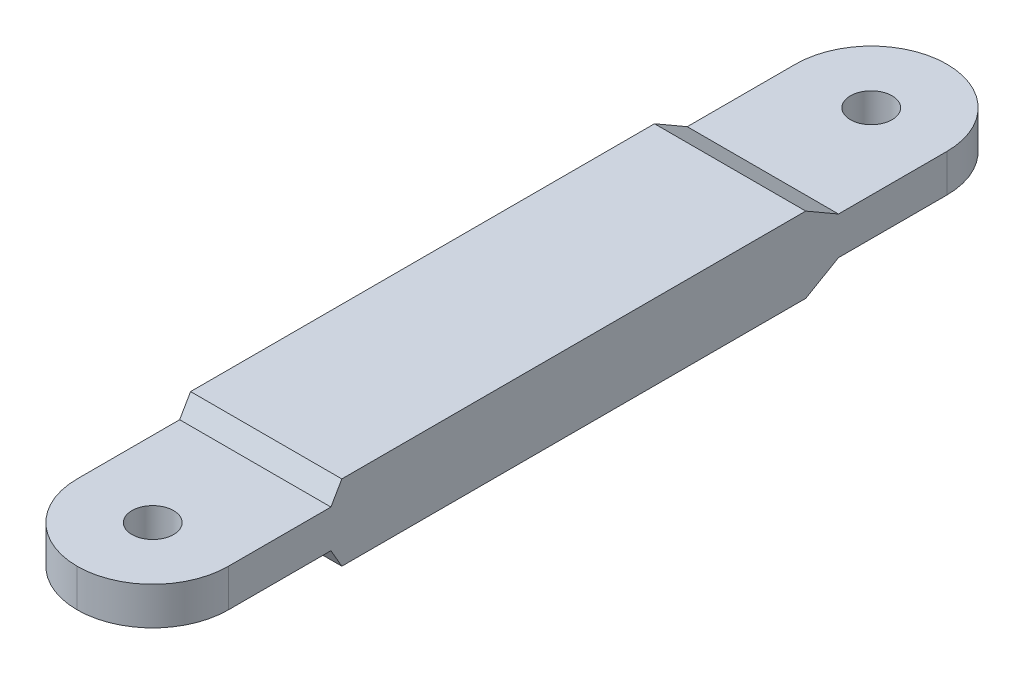
from build123d import *

# Parameters (mm, degrees)
BOSS_EXTRUDE1_DEPTH      = 37.5
BOSS_EXTRUDE1_DEPTH_BACK = 37.5
SKETCH1_W                = 20
SKETCH1_H                = 10
SKETCH3_W                = 20
SKETCH3_H                = 5
BOSS_EXTRUDE2_DEPTH      = 20
FILLET1_R                = 10
SKETCH4_R                = 2.75
CUT_EXTRUDE1_DEPTH       = 59.84301148
FILLET1_OF_MIRROR3_R     = 10
CHAMFER1_SIZE            = 8.660254038
CHAMFER1_SIZE_2          = 5


# Some blends are built 0.0001 mm under size
with BuildPart() as part:
    # Sketch1 → Boss-Extrude1 (new, two sides: drawn at the far end of the back side and taken through both)
    with BuildSketch(Plane.XY.offset(-BOSS_EXTRUDE1_DEPTH_BACK)):
        Rectangle(SKETCH1_W, SKETCH1_H)
    extrude(amount=BOSS_EXTRUDE1_DEPTH + BOSS_EXTRUDE1_DEPTH_BACK)

    # Sketch3 → Boss-Extrude2 (add)
    with BuildSketch(Plane(origin=(0, 0, -37.5), x_dir=(-1, 0, 0), z_dir=(0, 0, -1))):
        Rectangle(SKETCH3_W, SKETCH3_H)
    boss_extrude2 = extrude(amount=BOSS_EXTRUDE2_DEPTH)

    # Fillet1
    fillet1_edges = [part.edges().sort_by_distance(p)[0] for p in [
        (-10, 0, -57.5),
        (10, 0, -57.5),
    ]]
    fillet(fillet1_edges, radius=FILLET1_R - 0.0001)  # a hair under: the kernel refuses the full size

    # Sketch4 → Cut-Extrude1 (cut, through all)
    with BuildSketch(Plane(origin=(0, 2.5, 0), x_dir=(1, 0, 0), z_dir=(0, 1, 0))):
        with Locations(Location((0, 47.5, 0), (0, 0, 270))):
            Circle(SKETCH4_R)
    cut_extrude1 = extrude(amount=-CUT_EXTRUDE1_DEPTH, mode=Mode.SUBTRACT)

    # Mirror3: Boss-Extrude2, Cut-Extrude1 across plane
    add(boss_extrude2.mirror(Plane.XY))
    add(cut_extrude1.mirror(Plane.XY), mode=Mode.SUBTRACT)

    # Fillet1 of Mirror3
    fillet1_of_mirror3_edges = [part.edges().sort_by_distance(p)[0] for p in [
        (-10, 0, 57.5),
        (10, 0, 57.5),
    ]]
    fillet(fillet1_of_mirror3_edges, radius=FILLET1_OF_MIRROR3_R - 0.0001)  # a hair under: the kernel refuses the full size

    # Chamfer1
    # the kernel refuses this chamfer: 8.660254038, 5 mm, written as the material it takes off along each edge
    with BuildSketch(Plane(origin=(32.404819853, 5, -37.5), x_dir=(0, 0.019326765612700598, 0.9998132206222078), z_dir=(-1, 0, 0))) as chamfer1_piece_1_section:
        Polygon((CHAMFER1_SIZE * 0.999813220604, -CHAMFER1_SIZE * 0.0193267656124), (-CHAMFER1_SIZE_2 * 0.0193267656127, -CHAMFER1_SIZE_2 * 0.999813220622), (0, 0), align=None)
    chamfer1_piece_1 = extrude(amount=64.809639706, mode=Mode.PRIVATE)
    chamfer1_piece_1 = split(chamfer1_piece_1, bisect_by=Plane(origin=(0, 2.5, -34.039331058), z_dir=(0, 1, 0)), keep=Keep.TOP, mode=Mode.PRIVATE)
    add(chamfer1_piece_1, mode=Mode.SUBTRACT)
    with BuildSketch(Plane(origin=(-32.404819853, -5, -37.5), x_dir=(0, -0.019326765612700598, 0.9998132206222078), z_dir=(1, 0, 0))) as chamfer1_piece_2_section:
        Polygon((CHAMFER1_SIZE * 0.999813220604, -CHAMFER1_SIZE * 0.0193267656124), (-CHAMFER1_SIZE_2 * 0.0193267656127, -CHAMFER1_SIZE_2 * 0.999813220622), (0, 0), align=None)
    chamfer1_piece_2 = extrude(amount=64.809639706, mode=Mode.PRIVATE)
    chamfer1_piece_2 = split(chamfer1_piece_2, bisect_by=Plane(origin=(0, -2.5, -34.039331058), z_dir=(0, -1, 0)), keep=Keep.TOP, mode=Mode.PRIVATE)
    add(chamfer1_piece_2, mode=Mode.SUBTRACT)
    with BuildSketch(Plane(origin=(-32.404819853, -5, 37.5), x_dir=(0, 0.999813220622208, 0.019326765612700494), z_dir=(1, 0, 0))) as chamfer1_piece_3_section:
        Polygon((CHAMFER1_SIZE * 0.999813220604, -CHAMFER1_SIZE * 0.0193267656124), (-CHAMFER1_SIZE_2 * 0.0193267656127, -CHAMFER1_SIZE_2 * 0.999813220622), (0, 0), align=None)
    chamfer1_piece_3 = extrude(amount=64.809639706, mode=Mode.PRIVATE)
    chamfer1_piece_3 = split(chamfer1_piece_3, bisect_by=Plane(origin=(0, 2.5, 37.476500167), z_dir=(0, 1, 0)), keep=Keep.TOP, mode=Mode.PRIVATE)
    add(chamfer1_piece_3, mode=Mode.SUBTRACT)
    with BuildSketch(Plane(origin=(-32.404819853, -5, 37.5), x_dir=(0, 0.999813220622208, 0.019326765612700494), z_dir=(1, 0, 0))) as chamfer1_piece_4_section:
        Polygon((CHAMFER1_SIZE * 0.999813220604, -CHAMFER1_SIZE * 0.0193267656124), (-CHAMFER1_SIZE_2 * 0.0193267656127, -CHAMFER1_SIZE_2 * 0.999813220622), (0, 0), align=None)
    chamfer1_piece_4 = extrude(amount=64.809639706, mode=Mode.PRIVATE)
    chamfer1_piece_4 = split(chamfer1_piece_4, bisect_by=Plane(origin=(0, -2.5, 35.327003025), z_dir=(0, -1, 0)), keep=Keep.TOP, mode=Mode.PRIVATE)
    add(chamfer1_piece_4, mode=Mode.SUBTRACT)
    with BuildSketch(Plane(origin=(32.404819853, 5, 37.5), x_dir=(0, -0.999813220622208, 0.019326765612700494), z_dir=(-1, 0, 0))) as chamfer1_piece_5_section:
        Polygon((CHAMFER1_SIZE * 0.999813220604, -CHAMFER1_SIZE * 0.0193267656124), (-CHAMFER1_SIZE_2 * 0.0193267656127, -CHAMFER1_SIZE_2 * 0.999813220622), (0, 0), align=None)
    chamfer1_piece_5 = extrude(amount=64.809639706, mode=Mode.PRIVATE)
    chamfer1_piece_5 = split(chamfer1_piece_5, bisect_by=Plane(origin=(0, -2.5, 37.476500167), z_dir=(0, -1, 0)), keep=Keep.TOP, mode=Mode.PRIVATE)
    add(chamfer1_piece_5, mode=Mode.SUBTRACT)
    with BuildSketch(Plane(origin=(32.404819853, 5, 37.5), x_dir=(0, -0.999813220622208, 0.019326765612700494), z_dir=(-1, 0, 0))) as chamfer1_piece_6_section:
        Polygon((CHAMFER1_SIZE * 0.999813220604, -CHAMFER1_SIZE * 0.0193267656124), (-CHAMFER1_SIZE_2 * 0.0193267656127, -CHAMFER1_SIZE_2 * 0.999813220622), (0, 0), align=None)
    chamfer1_piece_6 = extrude(amount=64.809639706, mode=Mode.PRIVATE)
    chamfer1_piece_6 = split(chamfer1_piece_6, bisect_by=Plane(origin=(0, 2.5, 35.327003025), z_dir=(0, 1, 0)), keep=Keep.TOP, mode=Mode.PRIVATE)
    add(chamfer1_piece_6, mode=Mode.SUBTRACT)


solid = part.part
